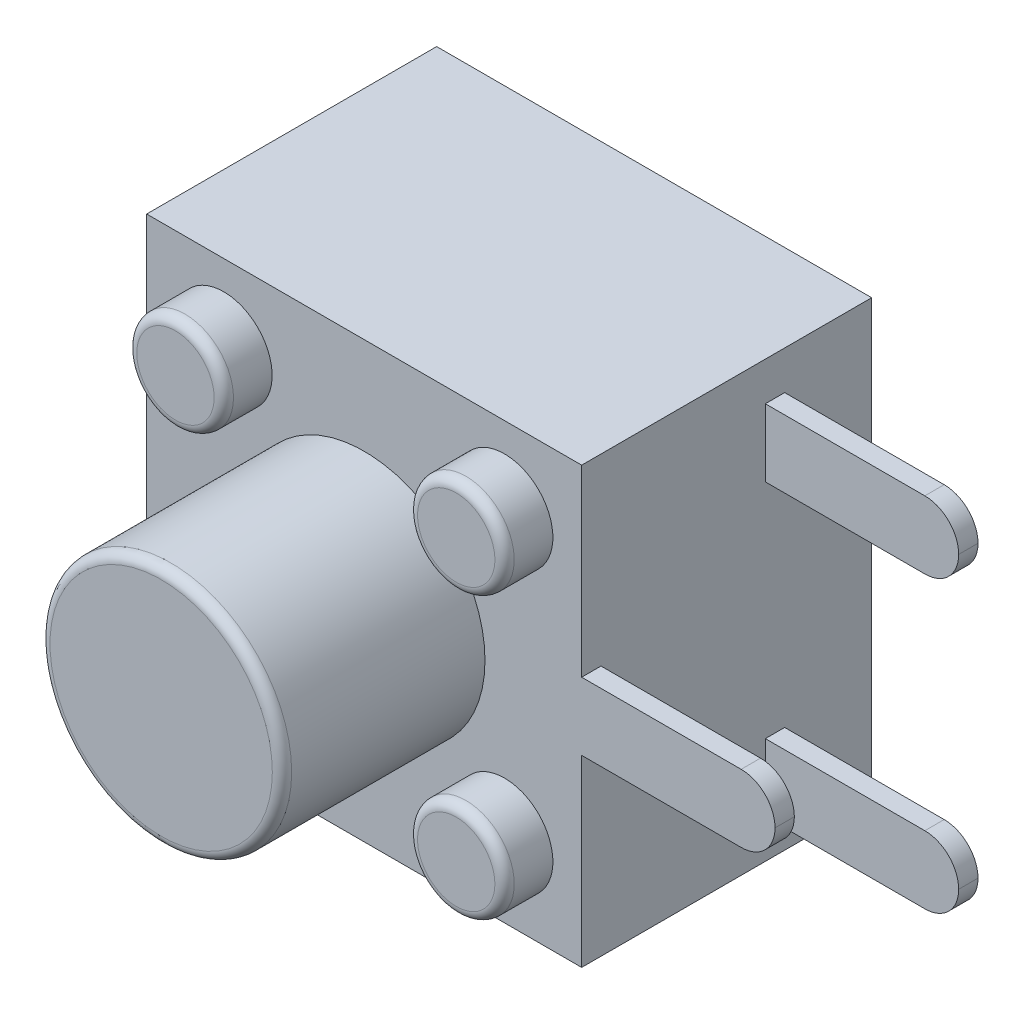
from build123d import *

# Parameters (mm, degrees)
SKETCH1_W           = 4.5
SKETCH1_H           = 4.5
BOSS_EXTRUDE1_DEPTH = 3
SKETCH4_R           = 0.5
BOSS_EXTRUDE3_DEPTH = 0.5
FILLET1_R           = 0.1
SKETCH5_R           = 1.25
BOSS_EXTRUDE4_DEPTH = 2.1
FILLET2_R           = 0.1
SKETCH6_W           = 2
SKETCH6_H           = 0.7
BOSS_EXTRUDE5_DEPTH = 0.2
SKETCH7_W           = 2
SKETCH7_H           = 0.7
BOSS_EXTRUDE6_DEPTH = 0.1
FILLET3_R           = 0.35


with BuildPart() as part:
    # Sketch1 → Boss-Extrude1 (new body)
    with BuildSketch(Plane.XY):
        Rectangle(SKETCH1_W, SKETCH1_H)
    extrude(amount=BOSS_EXTRUDE1_DEPTH)

    # Sketch4 → Boss-Extrude3 (add)
    with BuildSketch(Plane.XY.offset(3)):
        with Locations(Location((-1.45218189, 1.45218189, 0), (0, 0, 180))):
            Circle(SKETCH4_R)
        with Locations(Location((1.45218189, 1.45218189, 0), (0, 0, 180))):
            Circle(SKETCH4_R)
        with Locations(Location((1.45218189, -1.45218189, 0), (0, 0, 180))):
            Circle(SKETCH4_R)
        with Locations(Location((-1.45218189, -1.45218189, 0), (0, 0, 180))):
            Circle(SKETCH4_R)
    extrude(amount=BOSS_EXTRUDE3_DEPTH)

    # Fillet1
    fillet1_edges = [part.edges().sort_by_distance(p)[0] for p in [
        (-0.95218189, 1.45218189, 3.5),
        (1.95218189, 1.45218189, 3.5),
        (1.95218189, -1.45218189, 3.5),
        (-0.95218189, -1.45218189, 3.5),
    ]]
    fillet(fillet1_edges, radius=FILLET1_R)

    # Sketch5 → Boss-Extrude4 (add)
    with BuildSketch(Plane.XY.offset(3)):
        with Locations(Location((0, 0, 0), (0, 0, 180))):
            Circle(SKETCH5_R)
    extrude(amount=BOSS_EXTRUDE4_DEPTH)

    # Fillet2
    fillet2_edges = [part.edges().sort_by_distance(p)[0] for p in [
        (1.25, 0, 5.1),
    ]]
    fillet(fillet2_edges, radius=FILLET2_R)

    # Sketch6 → Boss-Extrude5 (add)
    with BuildSketch(Plane.XY.offset(3)):
        with Locations((3.25, 0)):
            Rectangle(SKETCH6_W, SKETCH6_H)
    extrude(amount=-BOSS_EXTRUDE5_DEPTH)

    # Sketch7 → Boss-Extrude6 (add, symmetric)
    with BuildSketch(Plane(origin=(0, 0, 1), x_dir=(-1, 0, 0), z_dir=(0, 0, -1))):
        with Locations((-3.25, -1.5)):
            Rectangle(SKETCH7_W, SKETCH7_H)
        with Locations((-3.25, 1.5)):
            Rectangle(SKETCH7_W, SKETCH7_H)
    extrude(amount=BOSS_EXTRUDE6_DEPTH, both=True)

    # Fillet3
    fillet3_edges = [part.edges().sort_by_distance(p)[0] for p in [
        (4.25, 1.85, 1),
        (4.25, 1.15, 1),
        (4.25, -0.35, 2.9),
        (4.25, 0.35, 2.9),
        (4.25, -1.15, 1),
        (4.25, -1.85, 1),
    ]]
    fillet(fillet3_edges, radius=FILLET3_R - 0.0001)  # a hair under: the kernel refuses the full size


solid = part.part
